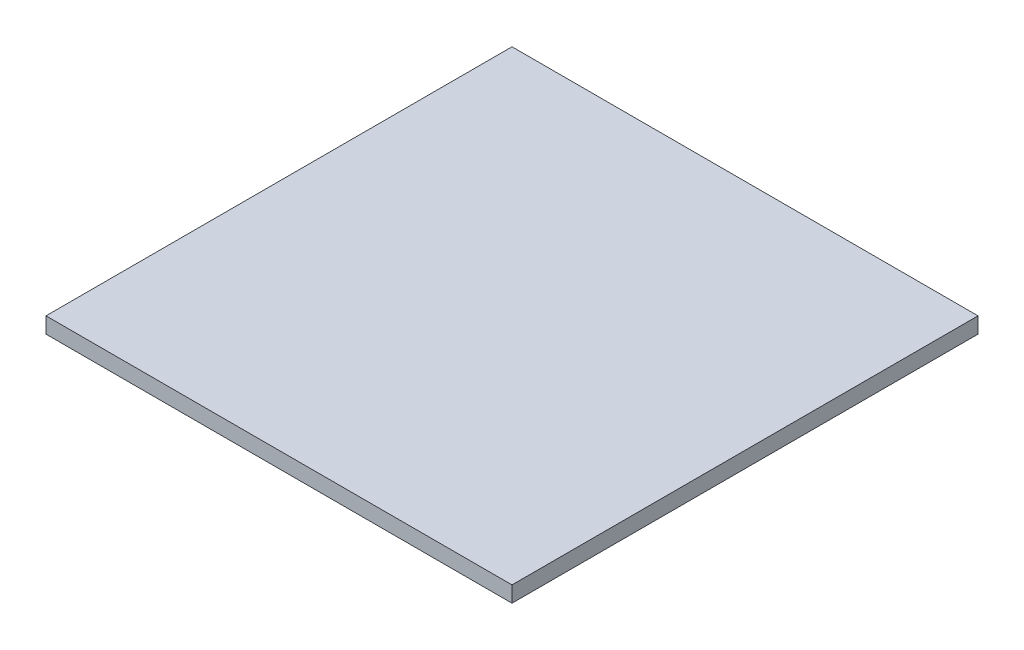
from build123d import *

# Parameters (mm, degrees)
SKETCH1_W           = 558.8
SKETCH1_H           = 558.8
BOSS_EXTRUDE1_DEPTH = 19.05


with BuildPart() as part:
    # Sketch1 → Boss-Extrude1 (new body)
    with BuildSketch(Plane(origin=(0, 0, 0), x_dir=(1, 0, 0), z_dir=(0, 1, 0))):
        with Locations((-260.00984602, 279.4)):
            Rectangle(SKETCH1_W, SKETCH1_H)
    extrude(amount=BOSS_EXTRUDE1_DEPTH)


solid = part.part
